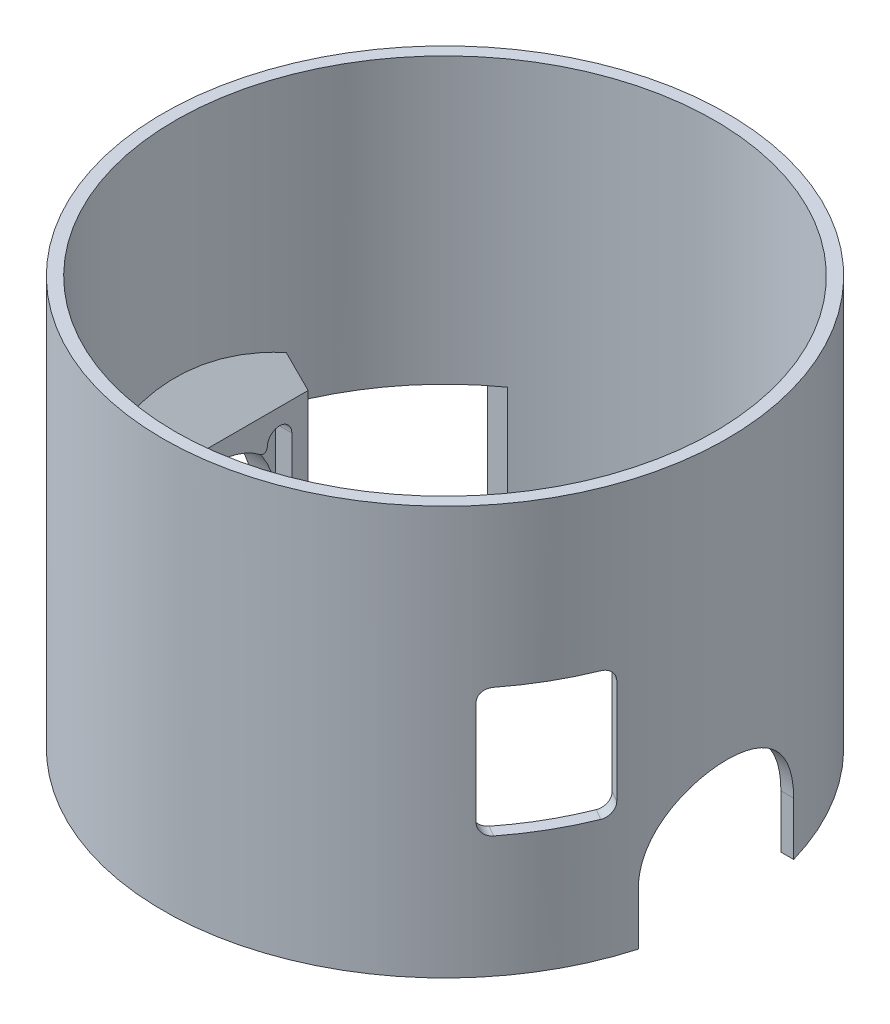
from build123d import *

# Parameters (mm, degrees)
SKETCH1_R               = 69
SKETCH1_R_2             = 66
BOSS_EXTRUDE1_DEPTH     = 100
CUT_EXTRUDE1_REACH      = 200.205
SKETCH3_W               = 20
SKETCH3_H               = 28
FILLET1_R               = 3
SKETCH4_W               = 30.4
SKETCH4_H               = 30.4
CUT_EXTRUDE2_DEPTH      = 140.721151039
CUT_EXTRUDE6_DEPTH      = 140.721151039
CUT_EXTRUDE6_DEPTH_BACK = 140.721151039
BOSS_EXTRUDE2_REACH     = 198.221
BOSS_EXTRUDE2_START     = -56.5
SKETCH8_W               = 46
SKETCH8_H               = 35
BOSS_EXTRUDE4_DEPTH     = 30
SKETCH9_OUTSIDE_W       = 207.751
SKETCH9_OUTSIDE_H       = 186.632
SKETCH9_OUTSIDE_R       = 69
CUT_EXTRUDE7_DEPTH      = 152.269287203
CUT_EXTRUDE8_DEPTH      = 140.721151039
CUT_EXTRUDE9_DEPTH      = 140.721151039
CUT_EXTRUDE10_REACH     = 200.205
SKETCH10_W              = 25.2
SKETCH10_H              = 31.5
FILLET2_R               = 3
CUT_EXTRUDE11_DEPTH     = 4
FILLET3_R               = 1


with BuildPart() as part:
    # Sketch1 → Boss-Extrude1 (new body)
    with BuildSketch(Plane(origin=(0, 0, 0), x_dir=(1, 0, 0), z_dir=(0, 1, 0))):
        Circle(SKETCH1_R)
        Circle(SKETCH1_R_2, mode=Mode.SUBTRACT)
    extrude(amount=BOSS_EXTRUDE1_DEPTH)

    # Sketch3 → Cut-Extrude1 (cut, up to next)
    with BuildSketch(Plane(origin=(-64.951905284, 0, 37.5), x_dir=(-0.5000000000000016, 0, -0.8660254037844378), z_dir=(0.8660254037844377, 0, -0.5000000000000014)), mode=Mode.PRIVATE) as cut_extrude1_sk1:
        with Locations((0, 45.5)):
            Rectangle(SKETCH3_W, SKETCH3_H)
    cut_extrude1_tool1 = extrude(cut_extrude1_sk1.sketch, amount=CUT_EXTRUDE1_REACH, mode=Mode.PRIVATE) & part.part
    add(cut_extrude1_tool1.solids().sort_by_distance((-64.951905, 45.5, 37.5))[0], mode=Mode.SUBTRACT)

    # Fillet1
    fillet1_edges = [part.edges().sort_by_distance(p)[0] for p in [
        (-52.811327716, 31.5, 42.037639657),
        (-62.811327716, 31.5, 24.717131581),
        (-52.811327716, 59.5, 42.037639657),
        (-62.811327716, 59.5, 24.717131581),
    ]]
    fillet(fillet1_edges, radius=FILLET1_R)

    # Sketch4 → Cut-Extrude2 (cut, through all)
    with BuildSketch(Plane(origin=(0, 0, 0), x_dir=(0, 0, -1), z_dir=(1, 0, 0))):
        with Locations((38.5, 15.2)):
            Rectangle(SKETCH4_W, SKETCH4_H)
    extrude(amount=-CUT_EXTRUDE2_DEPTH, mode=Mode.SUBTRACT)

    # Sketch5 → Cut-Extrude6 (cut, two sides: drawn at the far end of the back side and taken through both)
    with BuildSketch(Plane(origin=(0, 0, 0), x_dir=(0, 0, -1), z_dir=(1, 0, 0)).offset(-CUT_EXTRUDE6_DEPTH_BACK)):
        with BuildLine():
            Line((19, 13), (19, -6))
            Line((19, -6), (-19, -6))
            Line((-19, -6), (-19, 13))
            ThreePointArc((-19, 13), (0, 32), (19, 13))
        make_face()
    extrude(amount=CUT_EXTRUDE6_DEPTH + CUT_EXTRUDE6_DEPTH_BACK, mode=Mode.SUBTRACT)

    # Sketch6 → Boss-Extrude2 (add, up to next)
    with BuildSketch(Plane(origin=(0, 0, 0), x_dir=(0, 0, -1), z_dir=(1, 0, 0)).offset(BOSS_EXTRUDE2_START), mode=Mode.PRIVATE) as boss_extrude2_sk1:
        with BuildLine():
            Line((19, 13), (19, 0))
            Line((19, 0), (23, 0))
            Line((23, 0), (23, 13))
            ThreePointArc((23, 13), (0, 36), (-23, 13))
            Line((-23, 13), (-23, 0))
            Line((-23, 0), (-19, 0))
            Line((-19, 0), (-19, 13))
            ThreePointArc((-19, 13), (0, 32), (19, 13))
        make_face()
    boss_extrude2_tool1 = extrude(boss_extrude2_sk1.sketch, amount=-BOSS_EXTRUDE2_REACH, mode=Mode.PRIVATE) - part.part
    add(boss_extrude2_tool1.solids().sort_by_distance((-56.5, 6.5, 22.415877))[0])

    # Sketch8 → Boss-Extrude4 (add)
    with BuildSketch(Plane(origin=(-10.25, -10.25, 0), x_dir=(0, 0, -1), z_dir=(-0.7071067811865512, -0.7071067811865438, 0))):
        with Locations((0, -65.451533137)):
            Rectangle(SKETCH8_W, SKETCH8_H)
    extrude(amount=BOSS_EXTRUDE4_DEPTH)

    # Sketch9 outside → Cut-Extrude7 (cut, through all)
    with BuildSketch(Plane.XZ):
        with Locations((-10.5595, 0)):
            Rectangle(SKETCH9_OUTSIDE_W, SKETCH9_OUTSIDE_H)
        Circle(SKETCH9_OUTSIDE_R, mode=Mode.SUBTRACT)
    extrude(amount=-CUT_EXTRUDE7_DEPTH, mode=Mode.SUBTRACT)

    # Sketch9<3> → Cut-Extrude8 (cut, through all)
    with BuildSketch(Plane.XZ):
        with BuildLine():
            ThreePointArc((-61.750384614, -23.3), (21.162519062, -62.515180452), (63.206012372, 19))
            ThreePointArc((63.206012372, 19), (2.109760074, 65.966271021), (-61.862751313, 23))
            Line((-61.862751313, 23), (-56.5, 23))
            Line((-56.5, 23), (-56.5, 19))
            Line((-56.5, 19), (-56.5, -19))
            Line((-56.5, -19), (-56.5, -23))
            Line((-56.5, -23), (-61.862751313, -23))
            ThreePointArc((-61.862751313, -23), (-61.806749983, -23.150068176), (-61.750384614, -23.3))
        make_face()
    extrude(amount=-CUT_EXTRUDE8_DEPTH, mode=Mode.SUBTRACT)

    # Sketch5<2> → Cut-Extrude9 (cut, through all)
    with BuildSketch(Plane(origin=(0, 0, 0), x_dir=(0, 0, -1), z_dir=(1, 0, 0))):
        with BuildLine():
            Line((19, 13), (19, -6))
            Line((19, -6), (-19, -6))
            Line((-19, -6), (-19, 13))
            ThreePointArc((-19, 13), (0, 32), (19, 13))
        make_face()
    extrude(amount=-CUT_EXTRUDE9_DEPTH, mode=Mode.SUBTRACT)

    # Sketch10 → Cut-Extrude10 (cut, up to next)
    with BuildSketch(Plane(origin=(64.951905284, 0, 37.5), x_dir=(0.5000000000000006, 0, -0.8660254037844384), z_dir=(0.8660254037844384, 0, 0.5000000000000006)), mode=Mode.PRIVATE) as cut_extrude10_sk1:
        with Locations((0, 45.5)):
            Rectangle(SKETCH10_W, SKETCH10_H)
    cut_extrude10_tool1 = extrude(cut_extrude10_sk1.sketch, amount=-CUT_EXTRUDE10_REACH, mode=Mode.PRIVATE) & part.part
    add(cut_extrude10_tool1.solids().sort_by_distance((64.951905, 45.5, 37.5))[0], mode=Mode.SUBTRACT)

    # Fillet2
    fillet2_edges = [part.edges().sort_by_distance(p)[0] for p in [
        (51.128708368, 29.75, 44.068400323),
        (51.128708368, 61.25, 44.068400323),
        (63.728708368, 61.25, 22.244560148),
        (63.728708368, 29.75, 22.244560148),
    ]]
    fillet(fillet2_edges, radius=FILLET2_R)

    # Sketch11 → Cut-Extrude11 (cut)
    with BuildSketch(Plane(origin=(-56.5, 0, 0), x_dir=(0, 0, -1), z_dir=(1, 0, 0))):
        with BuildLine():
            Line((-19.000000298, 29.000000238), (-19, 11.000000238))
            Line((-19, 11.000000238), (-13.000000298, 11.000000238))
            Line((-13.000000298, 11.000000238), (-13.000000298, 29.000000238))
            ThreePointArc((-13.000000298, 29.000000238), (-16.000000298, 32.000000238), (-19.000000298, 29.000000238))
        make_face()
        with BuildLine():
            Line((12.999999702, 29.000000238), (12.999999702, 11.000000238))
            Line((12.999999702, 11.000000238), (19, 11.000000238))
            Line((19, 11.000000238), (18.999999702, 29.000000238))
            ThreePointArc((18.999999702, 29.000000238), (15.999999702, 32.000000238), (12.999999702, 29.000000238))
        make_face()
    extrude(amount=-CUT_EXTRUDE11_DEPTH, mode=Mode.SUBTRACT)

    # Fillet3
    fillet3_edges = [part.edges().sort_by_distance(p)[0] for p in [
        (-58.5, 26.85640674, -12.999999702),
        (-58.5, 26.856406181, 13.000000298),
    ]]
    fillet(fillet3_edges, radius=FILLET3_R)


solid = part.part
